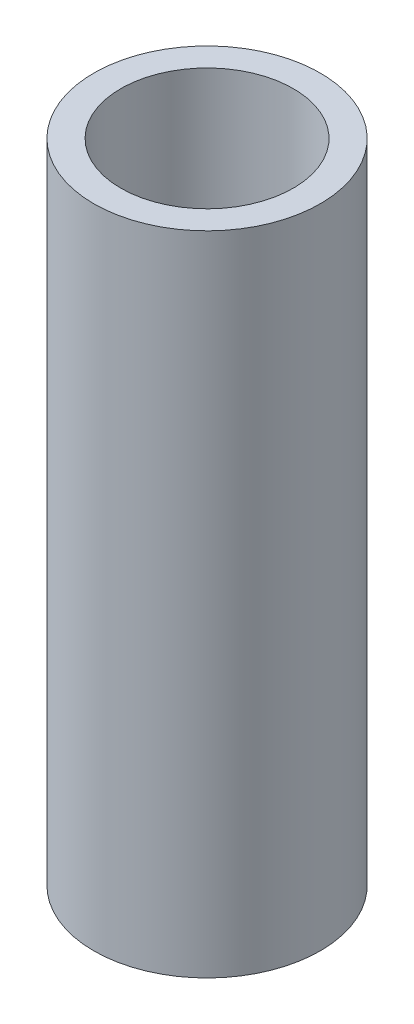
from build123d import *

# Parameters (mm, degrees)
SKETCH1_R           = 1.05
SKETCH1_R_2         = 0.8
BOSS_EXTRUDE1_DEPTH = 6


with BuildPart() as part:
    # Sketch1 → Boss-Extrude1 (new body)
    with BuildSketch(Plane(origin=(0, 0, 0), x_dir=(1, 0, 0), z_dir=(0, 1, 0))):
        Circle(SKETCH1_R)
        Circle(SKETCH1_R_2, mode=Mode.SUBTRACT)
    extrude(amount=BOSS_EXTRUDE1_DEPTH)


solid = part.part
